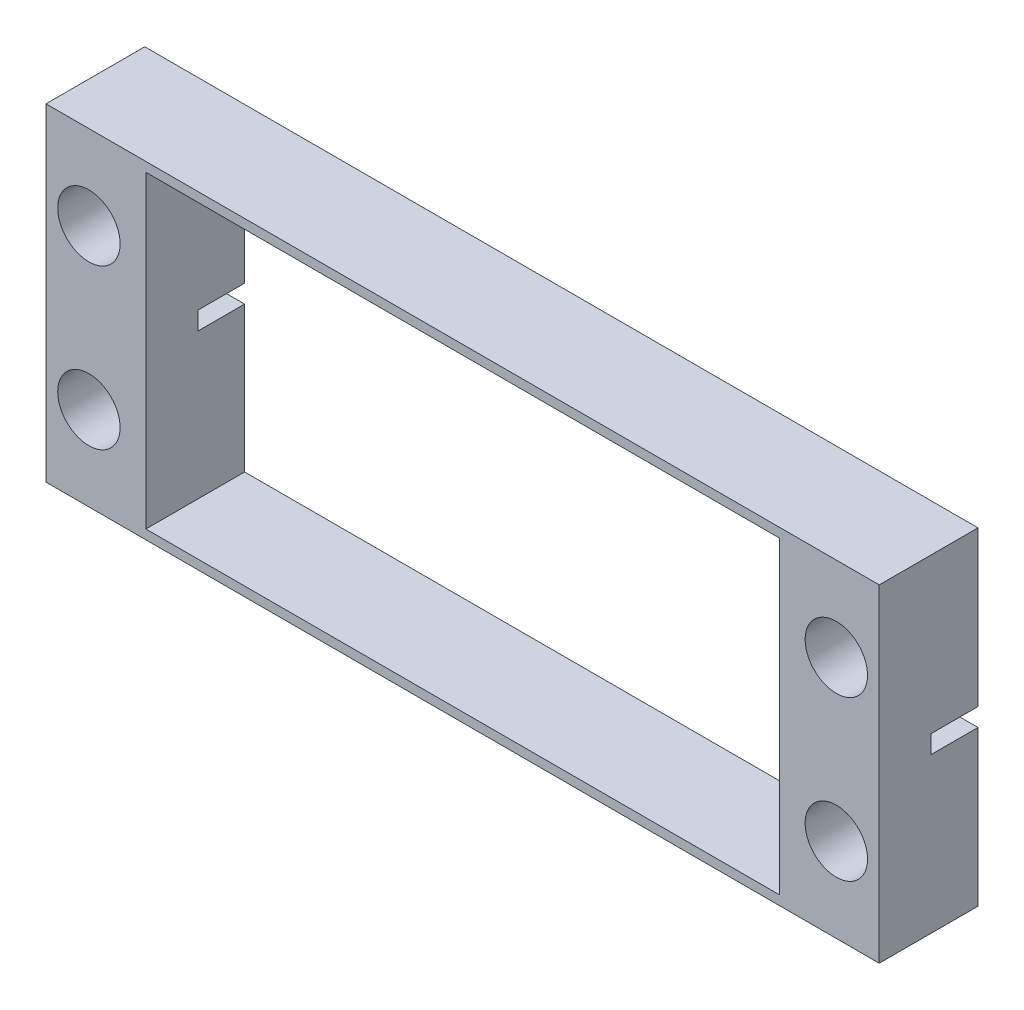
from build123d import *

# Parameters (mm, degrees)
SKETCH1_W           = 53.4
SKETCH1_H           = 21
BOSS_EXTRUDE2_DEPTH = 6.33
SKETCH3_W           = 40.6
SKETCH3_H           = 19.8
CUT_EXTRUDE1_DEPTH  = 30.380416947
SKETCH4_W           = 3
SKETCH4_H           = 1.16
CUT_EXTRUDE2_DEPTH  = 55.789404998
SKETCH5_R           = 2
CUT_EXTRUDE3_DEPTH  = 6.33


with BuildPart() as part:
    # Sketch1 → Boss-Extrude2 (new body)
    with BuildSketch(Plane.XY):
        Rectangle(SKETCH1_W, SKETCH1_H)
    extrude(amount=BOSS_EXTRUDE2_DEPTH)

    # Sketch3 → Cut-Extrude1 (cut, through all)
    with BuildSketch(Plane.XY.offset(6.33)):
        Rectangle(SKETCH3_W, SKETCH3_H)
    extrude(amount=-CUT_EXTRUDE1_DEPTH, mode=Mode.SUBTRACT)

    # Sketch4 → Cut-Extrude2 (cut, through all)
    with BuildSketch(Plane.ZY.offset(26.7)):
        with Locations((1.5, 0)):
            Rectangle(SKETCH4_W, SKETCH4_H)
    extrude(amount=-CUT_EXTRUDE2_DEPTH, mode=Mode.SUBTRACT)

    # Sketch5 → Cut-Extrude3 (cut)
    with BuildSketch(Plane.XY.offset(6.33)):
        with Locations((-23.95, 5.1)):
            Circle(SKETCH5_R)
        with Locations((-23.95, -5.1)):
            Circle(SKETCH5_R)
        with Locations((23.95, -5.1)):
            Circle(SKETCH5_R)
        with Locations((23.95, 5.1)):
            Circle(SKETCH5_R)
    extrude(amount=-CUT_EXTRUDE3_DEPTH, mode=Mode.SUBTRACT)


solid = part.part
